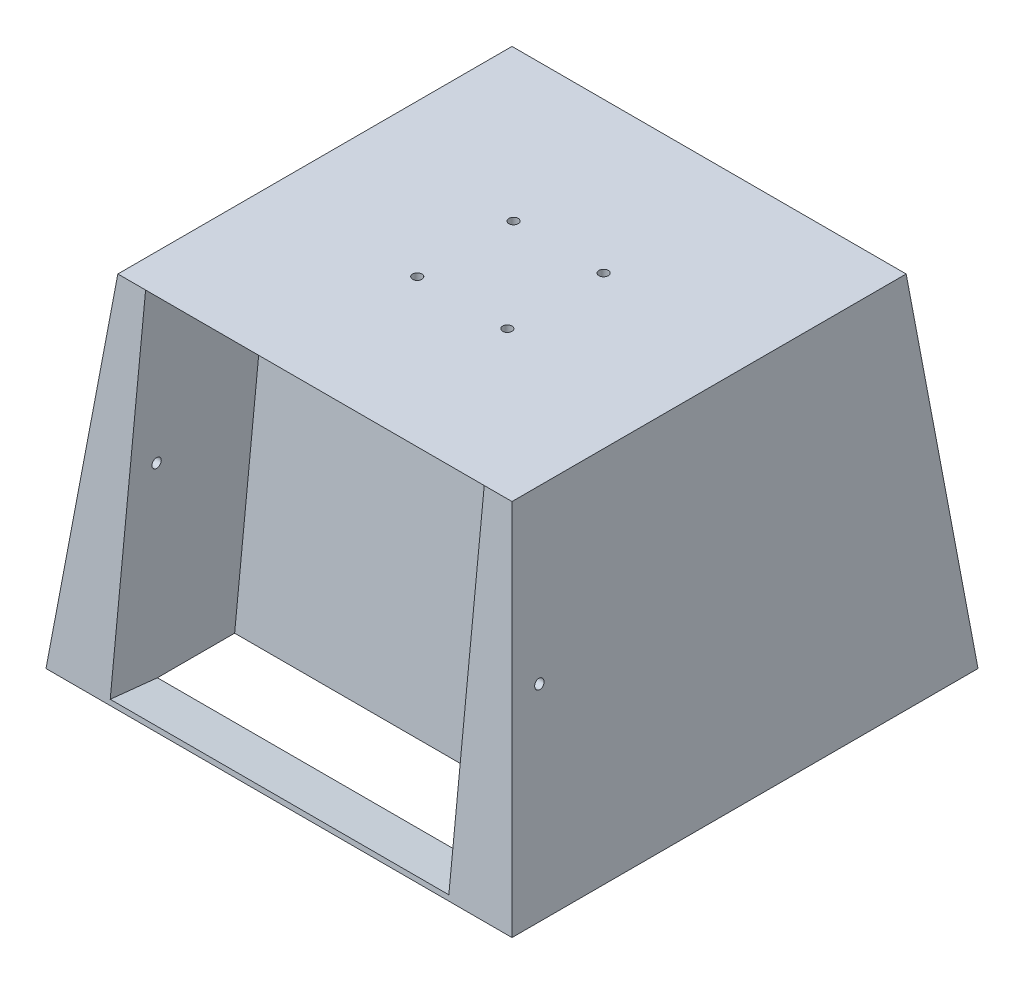
from build123d import *

# Parameters (mm, degrees)
SKETCH1_W               = 150
SKETCH1_H               = 150
BOSS_EXTRUDE1_DEPTH     = 110
BOSS_EXTRUDE1_TAPER     = 6
SKETCH14_W              = 109
SKETCH14_H              = 109
CUT_EXTRUDE2_DEPTH      = 40
CUT_EXTRUDE3_DEPTH      = 153.80706807
CUT_EXTRUDE3_DEPTH_BACK = 153.80706807
SKETCH17_R              = 1.5
SKETCH18_R              = 1.5
CUT_EXTRUDE4_DEPTH      = 20


with BuildPart() as part:
    # Sketch1 → Boss-Extrude1 (new body)
    with BuildSketch(Plane(origin=(0, 0, 0), x_dir=(1, 0, 0), z_dir=(0, 1, 0))):
        Rectangle(SKETCH1_W, SKETCH1_H)
    extrude(amount=BOSS_EXTRUDE1_DEPTH, taper=BOSS_EXTRUDE1_TAPER)

    # Sketch14 → Cut-Extrude2 (cut)
    with BuildSketch(Plane(origin=(0, 7.796688406, 74.180535028), x_dir=(1, 0, 0), z_dir=(0, 0.10452846326765353, 0.9945218953682734))):
        with Locations((0, 48.266276007)):
            Rectangle(SKETCH14_W, SKETCH14_H)
    extrude(amount=-CUT_EXTRUDE2_DEPTH, mode=Mode.SUBTRACT)

    # Sketch17 → Cut-Extrude3 (cut, two sides: drawn at the far end of the back side and taken through both)
    with BuildSketch(Plane(origin=(0, 0, 0), x_dir=(0, 0, -1), z_dir=(1, 0, 0)).offset(-CUT_EXTRUDE3_DEPTH_BACK)):
        with Locations((-59.896859992, 60)):
            Circle(SKETCH17_R)
    extrude(amount=CUT_EXTRUDE3_DEPTH + CUT_EXTRUDE3_DEPTH_BACK, mode=Mode.SUBTRACT)

    # Sketch18 → Cut-Extrude4 (cut)
    with BuildSketch(Plane(origin=(0, 110, 0), x_dir=(1, 0, 0), z_dir=(0, 1, 0))):
        with Locations((14.5, 15)):
            Circle(SKETCH18_R)
        with Locations((-14.5, 15)):
            Circle(SKETCH18_R)
        with Locations((14.5, -16)):
            Circle(SKETCH18_R)
        with Locations((-14.5, -16)):
            Circle(SKETCH18_R)
    extrude(amount=-CUT_EXTRUDE4_DEPTH, mode=Mode.SUBTRACT)


solid = part.part
